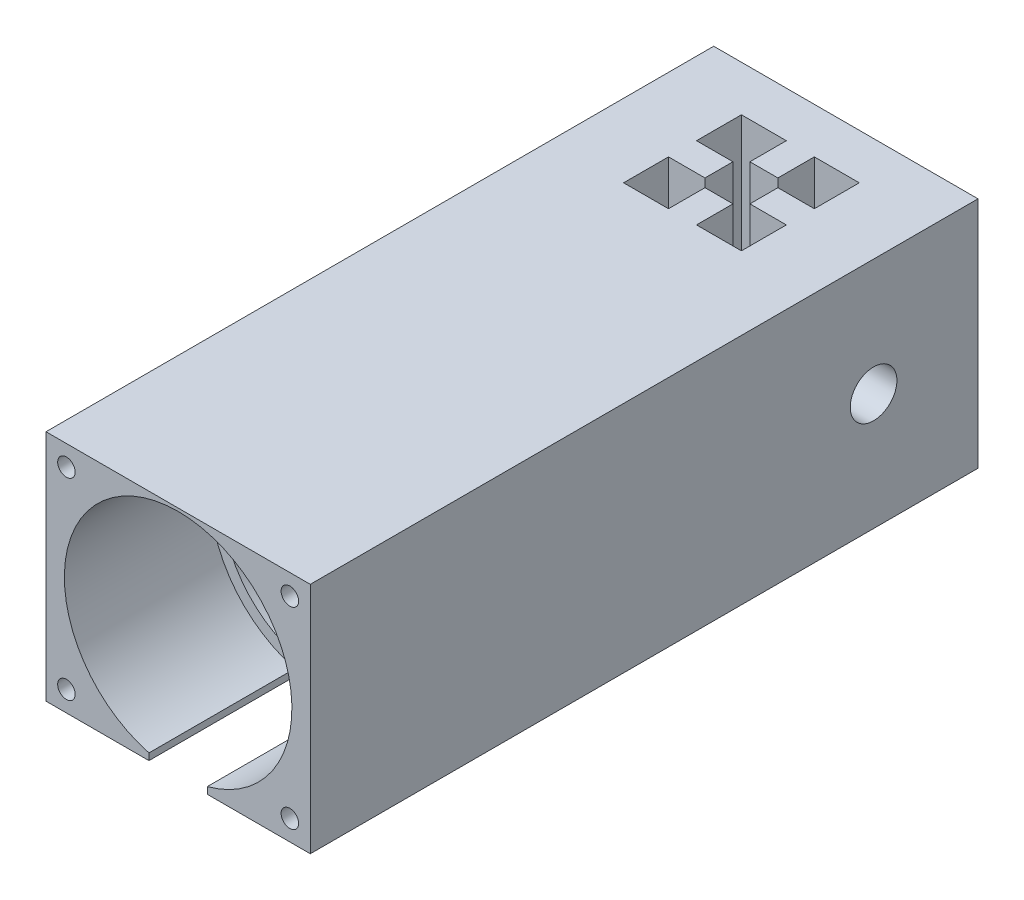
from build123d import *

# Parameters (mm, degrees)
BOSS_EXTRU_1_START                                = -20
BOSS_EXTRU_1_DEPTH                                = 40
ESQUISSE6_W                                       = 20.2
ESQUISSE6_H                                       = 20
ENL_V_MAT_EXTRU_1_DEPTH                           = 3
ESQUISSE14_W                                      = 30.8
ESQUISSE14_H                                      = 2.5
BOSS_EXTRU_3_DEPTH                                = 40
CHANFREIN1_SIZE                                   = 6.25
BOSS_EXTRU_4_DEPTH                                = 40
ESQUISSE21_W                                      = 45.3
ESQUISSE21_H                                      = 40
BOSS_EXTRU_5_DEPTH                                = 81.15
ESQUISSE22_R                                      = 17.5
ENL_V_MAT_EXTRU_2_DEPTH                           = 71.15
ESQUISSE23_W                                      = 10
ESQUISSE23_H                                      = 71.15
ENL_V_MAT_EXTRU_6_DEPTH                           = 6.15
ESQUISSE24_R                                      = 19.5
ENL_V_MAT_EXTRU_7_DEPTH                           = 25
ESQUISSE25_W                                      = 33.3
ESQUISSE25_H                                      = 40
BOSS_EXTRU_6_DEPTH                                = 7.25
CHAMBRAGE_POUR_VIS_SIX_PANS_CREUX_M42_D           = 4.5
CHAMBRAGE_POUR_VIS_SIX_PANS_CREUX_M42_DEPTH       = 12.55
CHAMBRAGE_POUR_VIS_SIX_PANS_CREUX_M42_CBORE_D     = 8
CHAMBRAGE_POUR_VIS_SIX_PANS_CREUX_M42_CBORE_DEPTH = 8.25
ESQUISSE28_W                                      = 33.3
ESQUISSE28_H                                      = 40
BOSS_EXTRU_7_DEPTH                                = 7.25
CHAMBRAGE_POUR_VIS_SIX_PANS_CREUX_M43_D           = 4.5
CHAMBRAGE_POUR_VIS_SIX_PANS_CREUX_M43_CBORE_D     = 8
CHAMBRAGE_POUR_VIS_SIX_PANS_CREUX_M43_CBORE_DEPTH = 8.25
ESQUISSE34_R                                      = 1.5
ENL_V_MAT_EXTRU_8_DEPTH                           = 15


# Read off the part's stored shape, not the designer's step: Boss.-Extru.1
with BuildPart() as part:
    # Boss.-Extru.1 outline → Boss.-Extru.1 (new body)
    with BuildSketch(Plane(origin=(0, 0, 0), x_dir=(1, 0, 0), z_dir=(0, 1, 0)).offset(BOSS_EXTRU_1_START)):
        Polygon((-10.1, -2.4), (-3.85, -2.4), (-3.85, 2.4), (-10.1, 2.4), (-10.1, 10.1), (-2.4, 10.1), (-2.4, 3.85), (2.4, 3.85), (2.4, 10.1), (10.1, 10.1), (10.1, 2.4), (3.85, 2.4), (3.85, -2.4), (10.1, -2.4), (10.1, -15.4), (15.4, -15.4), (15.4, 15.4), (-15.4, 15.4), (-15.4, -15.4), (-10.1, -15.4), align=None)
    extrude(amount=BOSS_EXTRU_1_DEPTH)

    # Esquisse6 → Enlèv. mat.-Extru.1 (cut, symmetric)
    with BuildSketch(Plane.XY):
        Rectangle(ESQUISSE6_W, ESQUISSE6_H)
    extrude(amount=ENL_V_MAT_EXTRU_1_DEPTH, both=True, mode=Mode.SUBTRACT)

    # Esquisse14 → Boss.-Extru.3 (add)
    with BuildSketch(Plane.XZ.offset(20)):
        with Locations((0, -16.65)):
            Rectangle(ESQUISSE14_W, ESQUISSE14_H)
    extrude(amount=-BOSS_EXTRU_3_DEPTH)

    # Chanfrein1
    chanfrein1_edges = [part.edges().sort_by_distance(p)[0] for p in [
        (3.85, -10, 0),
        (-3.85, -10, 0),
    ]]
    chamfer(chanfrein1_edges, length=CHANFREIN1_SIZE - 0.0001)  # a hair under: the kernel refuses the full size

    # Esquisse20 → Boss.-Extru.4 (add)
    with BuildSketch(Plane(origin=(0, 20, 0), x_dir=(1, 0, 0), z_dir=(0, 1, 0))):
        Polygon((-10.1, -15.4), (10.1, -15.4), (10.1, -10.097741972), (2.4, -10.097741972), (2.4, -3.847741972), (-2.4, -3.847741972), (-2.4, -10.097741972), (-10.1, -10.097741972), align=None)
    extrude(amount=-BOSS_EXTRU_4_DEPTH)

    # Esquisse21 → Boss.-Extru.5 (add)
    with BuildSketch(Plane.XY.offset(15.4)):
        Rectangle(ESQUISSE21_W, ESQUISSE21_H)
    extrude(amount=BOSS_EXTRU_5_DEPTH)

    # Esquisse22 → Enlèv. mat.-Extru.2 (cut)
    with BuildSketch(Plane.XY.offset(96.55)):
        Circle(ESQUISSE22_R)
    extrude(amount=-ENL_V_MAT_EXTRU_2_DEPTH, mode=Mode.SUBTRACT)

    # Esquisse23 → Enlèv. mat.-Extru.6 (cut)
    with BuildSketch(Plane(origin=(0, -20, 0), x_dir=(-1, 0, 0), z_dir=(0, -1, 0))):
        with Locations((0, -60.975)):
            Rectangle(ESQUISSE23_W, ESQUISSE23_H)
    extrude(amount=-ENL_V_MAT_EXTRU_6_DEPTH, mode=Mode.SUBTRACT)

    # Esquisse24 → Enlèv. mat.-Extru.7 (cut)
    with BuildSketch(Plane.XY.offset(96.55)):
        Circle(ESQUISSE24_R)
    extrude(amount=-ENL_V_MAT_EXTRU_7_DEPTH, mode=Mode.SUBTRACT)

    # Esquisse25 → Boss.-Extru.6 (add)
    with BuildSketch(Plane(origin=(15.4, 0, 0), x_dir=(0, 0, -1), z_dir=(1, 0, 0))):
        with Locations((1.25, 0)):
            Rectangle(ESQUISSE25_W, ESQUISSE25_H)
    extrude(amount=BOSS_EXTRU_6_DEPTH)

    # Chambrage pour vis à six pans creux M42
    with Locations(Plane(origin=(22.65, 0, 0), x_dir=(0, 0, -1), z_dir=(1, 0, 0))):
        with Locations((0, 0)):
            CounterBoreHole(CHAMBRAGE_POUR_VIS_SIX_PANS_CREUX_M42_D / 2, CHAMBRAGE_POUR_VIS_SIX_PANS_CREUX_M42_CBORE_D / 2, CHAMBRAGE_POUR_VIS_SIX_PANS_CREUX_M42_CBORE_DEPTH, depth=CHAMBRAGE_POUR_VIS_SIX_PANS_CREUX_M42_DEPTH)

    # Esquisse28 → Boss.-Extru.7 (add)
    with BuildSketch(Plane.ZY.offset(15.4)):
        with Locations((-1.25, 0)):
            Rectangle(ESQUISSE28_W, ESQUISSE28_H)
    extrude(amount=BOSS_EXTRU_7_DEPTH)

    # Chambrage pour vis à six pans creux M43 (through all)
    with Locations(Plane.ZY.offset(22.65)):
        with Locations((0, 0)):
            CounterBoreHole(CHAMBRAGE_POUR_VIS_SIX_PANS_CREUX_M43_D / 2, CHAMBRAGE_POUR_VIS_SIX_PANS_CREUX_M43_CBORE_D / 2, CHAMBRAGE_POUR_VIS_SIX_PANS_CREUX_M43_CBORE_DEPTH)

    # Esquisse34 → Enlèv. mat.-Extru.8 (cut)
    with BuildSketch(Plane.XY.offset(96.55)):
        with Locations((-19.15, 16.5)):
            Circle(ESQUISSE34_R)
        with Locations((-19.15, -16.5)):
            Circle(ESQUISSE34_R)
        with Locations((19.15, 16.5)):
            Circle(ESQUISSE34_R)
        with Locations((19.15, -16.5)):
            Circle(ESQUISSE34_R)
    extrude(amount=-ENL_V_MAT_EXTRU_8_DEPTH, mode=Mode.SUBTRACT)


solid = part.part
